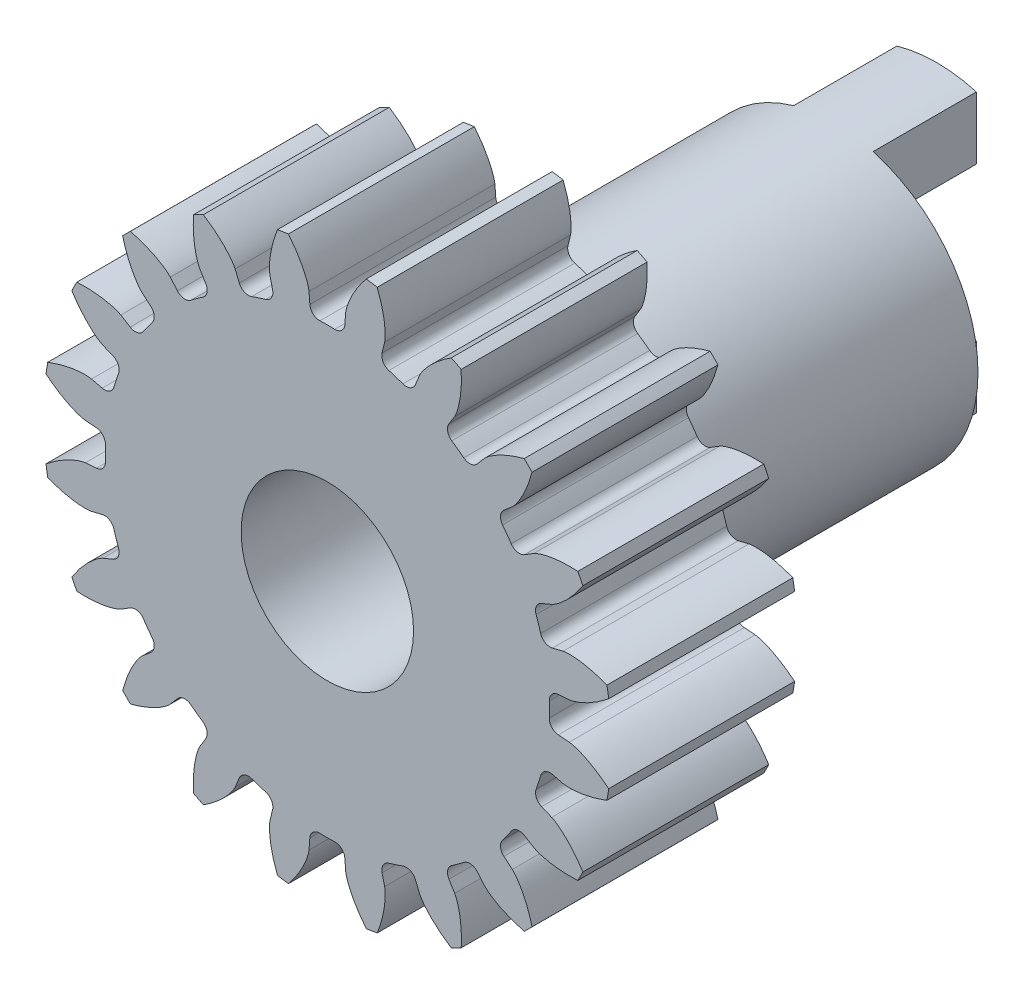
from build123d import *

# Parameters (mm, degrees)
BLANK_SKETCH_R      = 13.75
BLANK_DEPTH         = 9
TOOTH_SPACE_DEPTH   = 22.427202337
TEETH_COUNT         = 20
BORE_DEPTH          = 22.260792111
BORE_DEPTH_BACK     = 22.260792111
BORE_SKETCH_R       = 4.175
BOSS_EXTRUDE1_START = -50.25
SKETCH1_R           = 7
SKETCH1_R_2         = 4.175
BOSS_EXTRUDE1_DEPTH = 50.25
CUT_EXTRUDE1_DEPTH  = 5


with BuildPart() as part:
    # Blank Sketch → Blank (new body)
    with BuildSketch(Plane.XY):
        Circle(BLANK_SKETCH_R)
    extrude(amount=BLANK_DEPTH)

    # Tooth Space Sketch → Tooth Space (cut, symmetric)
    with BuildSketch(Plane.XY):
        with BuildLine():
            Line((11.712575542, 0.887578892), (11.182881902, 0.847438712))
            ThreePointArc((11.182881902, 0.847438712), (10.865110495, 0.690887858), (10.744037928, 0.357979056))
            ThreePointArc((10.744037928, 0.357979056), (10.75, 0), (10.744037928, -0.357979056))
            ThreePointArc((10.744037928, -0.357979056), (10.865110495, -0.690887858), (11.182881902, -0.847438712))
            Line((11.182881902, -0.847438712), (11.712575542, -0.887578892))
            add(Edge.make_bspline(
                [(11.712575542, -0.887578892), (11.718030456, -0.888084575), (11.733302224, -0.889786577), (11.762055049, -0.894123642), (11.808748116, -0.902783585), (11.867871522, -0.916136728), (11.943785045, -0.936044148), (12.032491205, -0.962883715), (12.129128281, -0.995906017), (12.233254944, -1.03560915), (12.336170252, -1.078535303), (12.437866469, -1.124417613), (12.538256203, -1.172869671), (12.658707015, -1.234774129), (12.801489519, -1.313454101), (12.965790887, -1.41181046), (13.148934646, -1.53083847), (13.331913845, -1.659992212), (13.508861665, -1.793481702), (13.683836959, -1.93555224), (13.850418726, -2.078105804), (14.019262166, -2.233337092), (14.17300458, -2.380287394), (14.340363277, -2.552637942), (14.474017151, -2.69399985), (14.607838338, -2.84630742), (14.672335873, -2.921355394), (14.70502791, -2.960093607)],
                knots=[0, 0, 0, 0, 0, 0.005376749, 0.015083688, 0.02853182, 0.046610139, 0.064854849, 0.092110525, 0.119476176, 0.146842496, 0.174208854, 0.201574956, 0.228941013, 0.256307345, 0.307035032, 0.361767352, 0.41649966, 0.471231936, 0.525964282, 0.580696615, 0.635428982, 0.690161387, 0.744893688, 0.799626082, 0.854358408, 0.909090915, 0.909090915, 0.909090915, 0.909090915, 0.909090915], degree=4))
            Line((14.70502791, -2.960093607), (14.70502791, 2.960093607))
            add(Edge.make_bspline(
                [(11.712575542, 0.887578892), (11.718030456, 0.888084575), (11.733302224, 0.889786577), (11.762055049, 0.894123642), (11.808748116, 0.902783585), (11.867871522, 0.916136728), (11.943785045, 0.936044148), (12.032491205, 0.962883715), (12.129128281, 0.995906017), (12.233254944, 1.03560915), (12.336170252, 1.078535303), (12.437866469, 1.124417613), (12.538256203, 1.172869671), (12.658707015, 1.234774129), (12.801489519, 1.313454101), (12.965790887, 1.41181046), (13.148934646, 1.53083847), (13.331913845, 1.659992212), (13.508861665, 1.793481702), (13.683836959, 1.93555224), (13.850418726, 2.078105804), (14.019262166, 2.233337092), (14.17300458, 2.380287394), (14.340363277, 2.552637942), (14.474017151, 2.69399985), (14.607838338, 2.84630742), (14.672335873, 2.921355394), (14.70502791, 2.960093607)],
                knots=[0, 0, 0, 0, 0, 0.005376749, 0.015083688, 0.02853182, 0.046610139, 0.064854849, 0.092110525, 0.119476176, 0.146842496, 0.174208854, 0.201574956, 0.228941013, 0.256307345, 0.307035032, 0.361767352, 0.41649966, 0.471231936, 0.525964282, 0.580696615, 0.635428982, 0.690161387, 0.744893688, 0.799626082, 0.854358408, 0.909090915, 0.909090915, 0.909090915, 0.909090915, 0.909090915], degree=4))
        make_face()
    tooth_space = extrude(amount=TOOTH_SPACE_DEPTH, both=True, mode=Mode.SUBTRACT)

    # Teeth: Tooth Space ×20 about axis
    teeth_axis = Axis((0, 0, -43.762507), (0, 0, 1))
    for i in range(1, TEETH_COUNT):
        add(tooth_space.rotate(teeth_axis, i * 360 / TEETH_COUNT), mode=Mode.SUBTRACT)

    # Bore Sketch → Bore (cut, two sides: drawn at the far end of the back side and taken through both)
    with BuildSketch(Plane.XY.offset(-BORE_DEPTH_BACK)):
        Circle(BORE_SKETCH_R)
    extrude(amount=BORE_DEPTH + BORE_DEPTH_BACK, mode=Mode.SUBTRACT)

    # Sketch1 → Boss-Extrude1 (add)
    with BuildSketch(Plane.XY.offset(9).offset(BOSS_EXTRUDE1_START)):
        Circle(SKETCH1_R)
        Circle(SKETCH1_R_2, mode=Mode.SUBTRACT)
    extrude(amount=BOSS_EXTRUDE1_DEPTH)

    # Split1
    split(bisect_by=Plane.XY.offset(-20.5), keep=Keep.TOP)

    # Sketch2 → Cut-Extrude1 (cut)
    with BuildSketch(Plane(origin=(0, 0, -20.5), x_dir=(-1, 0, 0), z_dir=(0, 0, -1))):
        with BuildLine():
            Line((-1.925, 6.730109583), (-1.925, -6.730109583))
            ThreePointArc((-1.925, -6.730109583), (-7, 0), (-1.925, 6.730109583))
        make_face()
        with BuildLine():
            Line((1.925, 6.730109583), (1.925, -6.730109583))
            ThreePointArc((1.925, -6.730109583), (7, 0), (1.925, 6.730109583))
        make_face()
    extrude(amount=-CUT_EXTRUDE1_DEPTH, mode=Mode.SUBTRACT)


solid = part.part
